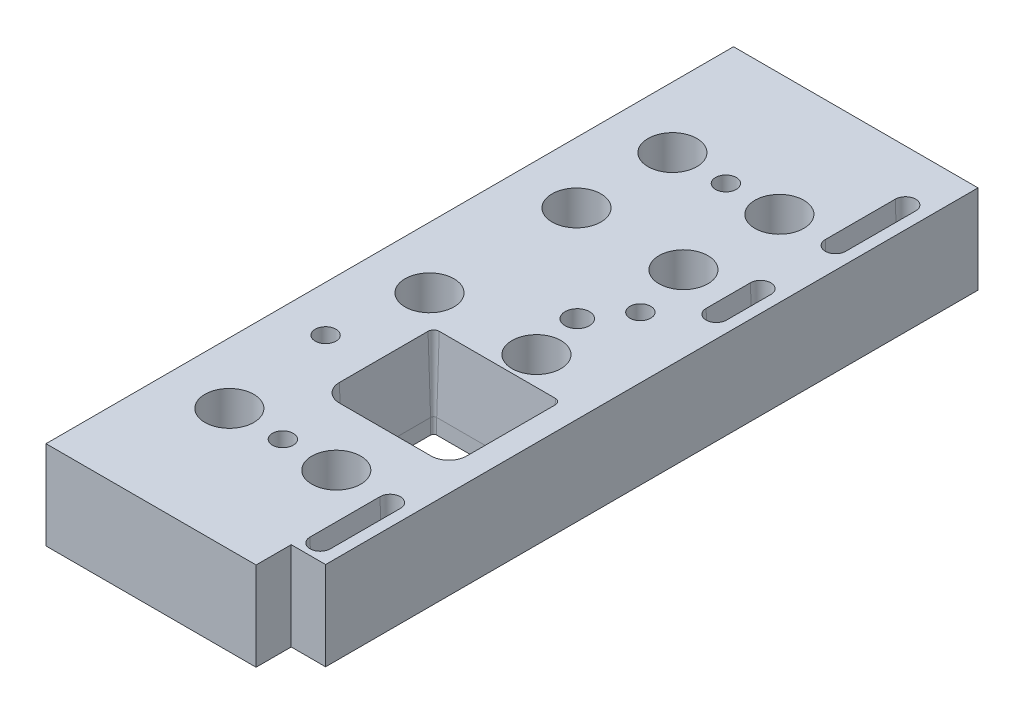
from build123d import *

# Parameters (mm, degrees)
SKETCH1_W             = 80
SKETCH1_H             = 225
BOSS_EXTRUDE1_DEPTH   = 29
CUT_EXTRUDE1_REACH    = 124.871
SKETCH3_R             = 8
CUT_EXTRUDE2_DEPTH    = 20
M8_TAPPED_HOLE1_D     = 6.8
M8_TAPPED_HOLE1_DEPTH = 19.75
M8_TAPPED_HOLE1_TIP   = 2.042926105
CUT_EXTRUDE3_REACH    = 124.871
SKETCH15_W            = 12
SKETCH15_H            = 11.5
SKETCH16_R            = 8.5
CUT_EXTRUDE4_DEPTH    = 5
CUT_EXTRUDE5_REACH    = 124.871
SKETCH17_R            = 4


with BuildPart() as part:
    # Sketch1 → Boss-Extrude1 (new body)
    with BuildSketch(Plane(origin=(0, 0, 0), x_dir=(1, 0, 0), z_dir=(0, 1, 0))):
        Rectangle(SKETCH1_W, SKETCH1_H)
    extrude(amount=-BOSS_EXTRUDE1_DEPTH)

    # Sketch2 → Cut-Extrude1 (cut, up to next)
    with BuildSketch(Plane(origin=(0, 0, 0), x_dir=(1, 0, 0), z_dir=(0, 1, 0)), mode=Mode.PRIVATE) as cut_extrude1_sk1:
        with BuildLine():
            Line((30.5, 72.87), (30.5, 95.77))
            ThreePointArc((30.5, 95.77), (33, 98.27), (35.5, 95.77))
            Line((35.5, 95.77), (35.5, 72.87))
            ThreePointArc((35.5, 72.87), (33, 70.37), (30.5, 72.87))
        make_face()
    cut_extrude1_tool1 = extrude(cut_extrude1_sk1.sketch, amount=-CUT_EXTRUDE1_REACH, mode=Mode.PRIVATE) & part.part
    # Sketch2 → Cut-Extrude1 (cut, up to next)
    with BuildSketch(Plane(origin=(0, 0, 0), x_dir=(1, 0, 0), z_dir=(0, 1, 0)), mode=Mode.PRIVATE) as cut_extrude1_sk2:
        with BuildLine():
            Line((30.5, 33.86), (30.5, 48.36))
            ThreePointArc((30.5, 48.36), (33, 50.86), (35.5, 48.36))
            Line((35.5, 48.36), (35.5, 33.86))
            ThreePointArc((35.5, 33.86), (33, 31.36), (30.5, 33.86))
        make_face()
    cut_extrude1_tool2 = extrude(cut_extrude1_sk2.sketch, amount=-CUT_EXTRUDE1_REACH, mode=Mode.PRIVATE) & part.part
    # Sketch2 → Cut-Extrude1 (cut, up to next)
    with BuildSketch(Plane(origin=(0, 0, 0), x_dir=(1, 0, 0), z_dir=(0, 1, 0)), mode=Mode.PRIVATE) as cut_extrude1_sk3:
        with BuildLine():
            Line((31.5, -47.14), (31.5, -18.14))
            ThreePointArc((31.5, -18.14), (31.207106781, -17.432893219), (30.5, -17.14))
            Line((30.5, -17.14), (-7.5, -17.14))
            ThreePointArc((-7.5, -17.14), (-8.207106781, -17.432893219), (-8.5, -18.14))
            Line((-8.5, -18.14), (-8.5, -47.14))
            ThreePointArc((-8.5, -47.14), (-7.035533906, -50.675533906), (-3.5, -52.14))
            Line((-3.5, -52.14), (26.5, -52.14))
            ThreePointArc((26.5, -52.14), (30.035533906, -50.675533906), (31.5, -47.14))
        make_face()
    cut_extrude1_tool3 = extrude(cut_extrude1_sk3.sketch, amount=-CUT_EXTRUDE1_REACH, mode=Mode.PRIVATE) & part.part
    # Sketch2 → Cut-Extrude1 (cut, up to next)
    with BuildSketch(Plane(origin=(0, 0, 0), x_dir=(1, 0, 0), z_dir=(0, 1, 0)), mode=Mode.PRIVATE) as cut_extrude1_sk4:
        with BuildLine():
            Line((30.5, -95.77), (30.5, -72.87))
            ThreePointArc((30.5, -72.87), (33, -70.37), (35.5, -72.87))
            Line((35.5, -72.87), (35.5, -95.77))
            ThreePointArc((35.5, -95.77), (33, -98.27), (30.5, -95.77))
        make_face()
    cut_extrude1_tool4 = extrude(cut_extrude1_sk4.sketch, amount=-CUT_EXTRUDE1_REACH, mode=Mode.PRIVATE) & part.part
    add(cut_extrude1_tool1.solids().sort_by_distance((33, 0, -84.32))[0], mode=Mode.SUBTRACT)
    add(cut_extrude1_tool2.solids().sort_by_distance((33, 0, -41.11))[0], mode=Mode.SUBTRACT)
    add(cut_extrude1_tool3.solids().sort_by_distance((11.5, 0, 34.518764))[0], mode=Mode.SUBTRACT)
    add(cut_extrude1_tool4.solids().sort_by_distance((33, 0, 84.32))[0], mode=Mode.SUBTRACT)

    # Sketch3 → Cut-Extrude2 (cut)
    with BuildSketch(Plane(origin=(0, 0, 0), x_dir=(1, 0, 0), z_dir=(0, 1, 0))):
        with Locations(Location((15, 72.5, 0), (0, 0, 270))):
            Circle(SKETCH3_R)
        with Locations(Location((15, 41.11, 0), (0, 0, 270))):
            Circle(SKETCH3_R)
        with Locations(Location((15, -7, 0), (0, 0, 270))):
            Circle(SKETCH3_R)
        with Locations(Location((15, -72.5, 0), (0, 0, 270))):
            Circle(SKETCH3_R)
        with Locations(Location((-20, -72.5, 0), (0, 0, 270))):
            Circle(SKETCH3_R)
        with Locations(Location((-20, -7, 0), (0, 0, 270))):
            Circle(SKETCH3_R)
        with Locations(Location((-20, 41.11, 0), (0, 0, 270))):
            Circle(SKETCH3_R)
        with Locations(Location((-20, 72.5, 0), (0, 0, 270))):
            Circle(SKETCH3_R)
    extrude(amount=-CUT_EXTRUDE2_DEPTH, mode=Mode.SUBTRACT)

    # M8 Tapped Hole1
    with Locations(Plane(origin=(0, 0, 0), x_dir=(1, 0, 0), z_dir=(0, 1, 0))):
        with Locations((-25, -36), (20, 22), (-2.5, 72.5), (-2.5, -72.5)):
            Hole(M8_TAPPED_HOLE1_D / 2, depth=M8_TAPPED_HOLE1_DEPTH)
            with Locations((0, 0, -(M8_TAPPED_HOLE1_DEPTH + M8_TAPPED_HOLE1_TIP / 2))):  # 118° drill point
                Cone(0, M8_TAPPED_HOLE1_D / 2, M8_TAPPED_HOLE1_TIP, mode=Mode.SUBTRACT)

    # Sketch15 → Cut-Extrude3 (cut, up to next)
    with BuildSketch(Plane(origin=(0, 0, 0), x_dir=(1, 0, 0), z_dir=(0, 1, 0)), mode=Mode.PRIVATE) as cut_extrude3_sk1:
        with Locations((34.75, -106.75)):
            Rectangle(SKETCH15_W, SKETCH15_H)
    cut_extrude3_tool1 = extrude(cut_extrude3_sk1.sketch, amount=-CUT_EXTRUDE3_REACH, mode=Mode.PRIVATE) & part.part
    add(cut_extrude3_tool1.solids().sort_by_distance((34.75, 0, 106.75))[0], mode=Mode.SUBTRACT)

    # Sketch16 → Cut-Extrude4 (cut)
    with BuildSketch(Plane.XZ.offset(29)):
        with Locations(Location((11.5, 100, 0), (0, 0, 270))):
            Circle(SKETCH16_R)
        with Locations(Location((11.5, -100, 0), (0, 0, 270))):
            Circle(SKETCH16_R)
    extrude(amount=-CUT_EXTRUDE4_DEPTH, mode=Mode.SUBTRACT)

    # Sketch17 → Cut-Extrude5 (cut, up to next)
    with BuildSketch(Plane(origin=(0, 0, 0), x_dir=(1, 0, 0), z_dir=(0, 1, 0)), mode=Mode.PRIVATE) as cut_extrude5_sk1:
        with Locations(Location((11.5, 9.86, 0), (0, 0, 270))):
            Circle(SKETCH17_R)
    cut_extrude5_tool1 = extrude(cut_extrude5_sk1.sketch, amount=-CUT_EXTRUDE5_REACH, mode=Mode.PRIVATE) & part.part
    add(cut_extrude5_tool1.solids().sort_by_distance((11.5, 0, -9.86))[0], mode=Mode.SUBTRACT)

    # Draft1: read off the stored shape, not the designer's step
    # Draft1: loft between two sections, ruled curve by curve
    draft1_from = [
        Edge.make_three_point_arc((30.5, -24, 95.77), (31.232233047, -24, 97.537766953), (33, -24, 98.27)),
        Edge.make_three_point_arc((33, -24, 98.27), (34.767766953, -24, 97.537766953), (35.5, -24, 95.77)),
        Edge.make_three_point_arc((35.5, -24, 72.87), (34.767766953, -24, 71.102233047), (33, -24, 70.37)),
        Edge.make_three_point_arc((33, -24, 70.37), (31.232233047, -24, 71.102233047), (30.5, -24, 72.87)),
        Edge.make_line((30.5, -24, 72.87), (30.5, -24, 95.77)),
        Edge.make_line((35.5, -24, 95.77), (35.5, -24, 72.87)),
    ]
    draft1_to = [
        Edge.make_three_point_arc((29.661901532, 0, 95.77), (30.639607937, 0, 98.130392063), (33, 0, 99.108098468)),
        Edge.make_three_point_arc((33, 0, 99.108098468), (35.360392063, 0, 98.130392063), (36.338098468, 0, 95.77)),
        Edge.make_three_point_arc((36.338098468, 0, 72.87), (35.360392063, 0, 70.509607937), (33, 0, 69.531901532)),
        Edge.make_three_point_arc((33, 0, 69.531901532), (30.639607937, 0, 70.509607937), (29.661901532, 0, 72.87)),
        Edge.make_line((29.661901532, 0, 72.87), (29.661901532, 0, 95.77)),
        Edge.make_line((36.338098468, 0, 95.77), (36.338098468, 0, 72.87)),
    ]
    draft1 = Solid(Shell([*[Face.make_surface_from_curves(draft1_from[k], draft1_to[k]) for k in range(6)], Face(Wire(draft1_from)), Face(Wire(draft1_to))]))
    add(draft1, mode=Mode.SUBTRACT)

    # Draft1 2: loft between two sections, ruled curve by curve
    draft1_2_from = [
        Edge.make_three_point_arc((30.5, -24, -33.86), (31.232233047, -24, -32.092233047), (33, -24, -31.36)),
        Edge.make_three_point_arc((33, -24, -31.36), (34.767766953, -24, -32.092233047), (35.5, -24, -33.86)),
        Edge.make_three_point_arc((35.5, -24, -48.36), (34.767766953, -24, -50.127766953), (33, -24, -50.86)),
        Edge.make_three_point_arc((33, -24, -50.86), (31.232233047, -24, -50.127766953), (30.5, -24, -48.36)),
        Edge.make_line((30.5, -24, -48.36), (30.5, -24, -33.86)),
        Edge.make_line((35.5, -24, -33.86), (35.5, -24, -48.36)),
    ]
    draft1_2_to = [
        Edge.make_three_point_arc((29.661901532, 0, -33.86), (30.639607937, 0, -31.499607937), (33, 0, -30.521901532)),
        Edge.make_three_point_arc((33, 0, -30.521901532), (35.360392063, 0, -31.499607937), (36.338098468, 0, -33.86)),
        Edge.make_three_point_arc((36.338098468, 0, -48.36), (35.360392063, 0, -50.720392063), (33, 0, -51.698098468)),
        Edge.make_three_point_arc((33, 0, -51.698098468), (30.639607937, 0, -50.720392063), (29.661901532, 0, -48.36)),
        Edge.make_line((29.661901532, 0, -48.36), (29.661901532, 0, -33.86)),
        Edge.make_line((36.338098468, 0, -33.86), (36.338098468, 0, -48.36)),
    ]
    draft1_2 = Solid(Shell([*[Face.make_surface_from_curves(draft1_2_from[k], draft1_2_to[k]) for k in range(6)], Face(Wire(draft1_2_from)), Face(Wire(draft1_2_to))]))
    add(draft1_2, mode=Mode.SUBTRACT)

    # Draft1 3: loft between two sections, ruled curve by curve
    draft1_3_from = [
        Edge.make_three_point_arc((30.5, -24, -72.87), (31.232233047, -24, -71.102233047), (33, -24, -70.37)),
        Edge.make_three_point_arc((33, -24, -70.37), (34.767766953, -24, -71.102233047), (35.5, -24, -72.87)),
        Edge.make_three_point_arc((35.5, -24, -95.77), (34.767766953, -24, -97.537766953), (33, -24, -98.27)),
        Edge.make_three_point_arc((33, -24, -98.27), (31.232233047, -24, -97.537766953), (30.5, -24, -95.77)),
        Edge.make_line((30.5, -24, -95.77), (30.5, -24, -72.87)),
        Edge.make_line((35.5, -24, -72.87), (35.5, -24, -95.77)),
    ]
    draft1_3_to = [
        Edge.make_three_point_arc((29.661901532, 0, -72.87), (30.639607937, 0, -70.509607937), (33, 0, -69.531901532)),
        Edge.make_three_point_arc((33, 0, -69.531901532), (35.360392063, 0, -70.509607937), (36.338098468, 0, -72.87)),
        Edge.make_three_point_arc((36.338098468, 0, -95.77), (35.360392063, 0, -98.130392063), (33, 0, -99.108098468)),
        Edge.make_three_point_arc((33, 0, -99.108098468), (30.639607937, 0, -98.130392063), (29.661901532, 0, -95.77)),
        Edge.make_line((29.661901532, 0, -95.77), (29.661901532, 0, -72.87)),
        Edge.make_line((36.338098468, 0, -72.87), (36.338098468, 0, -95.77)),
    ]
    draft1_3 = Solid(Shell([*[Face.make_surface_from_curves(draft1_3_from[k], draft1_3_to[k]) for k in range(6)], Face(Wire(draft1_3_from)), Face(Wire(draft1_3_to))]))
    add(draft1_3, mode=Mode.SUBTRACT)

    # Draft1 4: loft between two sections, ruled curve by curve
    draft1_4_from = [
        Edge.make_three_point_arc((26.5, -24, 52.14), (30.035533906, -24, 50.675533906), (31.5, -24, 47.14)),
        Edge.make_three_point_arc((-8.5, -24, 47.14), (-7.035533906, -24, 50.675533906), (-3.5, -24, 52.14)),
        Edge.make_three_point_arc((-7.5, -24, 17.14), (-8.207106781, -24, 17.432893219), (-8.5, -24, 18.14)),
        Edge.make_three_point_arc((31.5, -24, 18.14), (31.207106781, -24, 17.432893219), (30.5, -24, 17.14)),
        Edge.make_line((-3.5, -24, 52.14), (26.5, -24, 52.14)),
        Edge.make_line((-8.5, -24, 18.14), (-8.5, -24, 47.14)),
        Edge.make_line((30.5, -24, 17.14), (-7.5, -24, 17.14)),
        Edge.make_line((31.5, -24, 47.14), (31.5, -24, 18.14)),
    ]
    draft1_4_to = [
        Edge.make_three_point_arc((26.5, 0, 52.978098468), (30.628159016, 0, 51.268159016), (32.338098468, 0, 47.14)),
        Edge.make_three_point_arc((-9.338098468, 0, 47.14), (-7.628159016, 0, 51.268159016), (-3.5, 0, 52.978098468)),
        Edge.make_three_point_arc((-7.5, 0, 16.301901532), (-8.799731891, 0, 16.840268109), (-9.338098468, 0, 18.14)),
        Edge.make_three_point_arc((32.338098468, 0, 18.14), (31.799731891, 0, 16.840268109), (30.5, 0, 16.301901532)),
        Edge.make_line((-3.5, 0, 52.978098468), (26.5, 0, 52.978098468)),
        Edge.make_line((-9.338098468, 0, 18.14), (-9.338098468, 0, 47.14)),
        Edge.make_line((30.5, 0, 16.301901532), (-7.5, 0, 16.301901532)),
        Edge.make_line((32.338098468, 0, 47.14), (32.338098468, 0, 18.14)),
    ]
    draft1_4 = Solid(Shell([*[Face.make_surface_from_curves(draft1_4_from[k], draft1_4_to[k]) for k in range(8)], Face(Wire(draft1_4_from)), Face(Wire(draft1_4_to))]))
    add(draft1_4, mode=Mode.SUBTRACT)


solid = part.part
